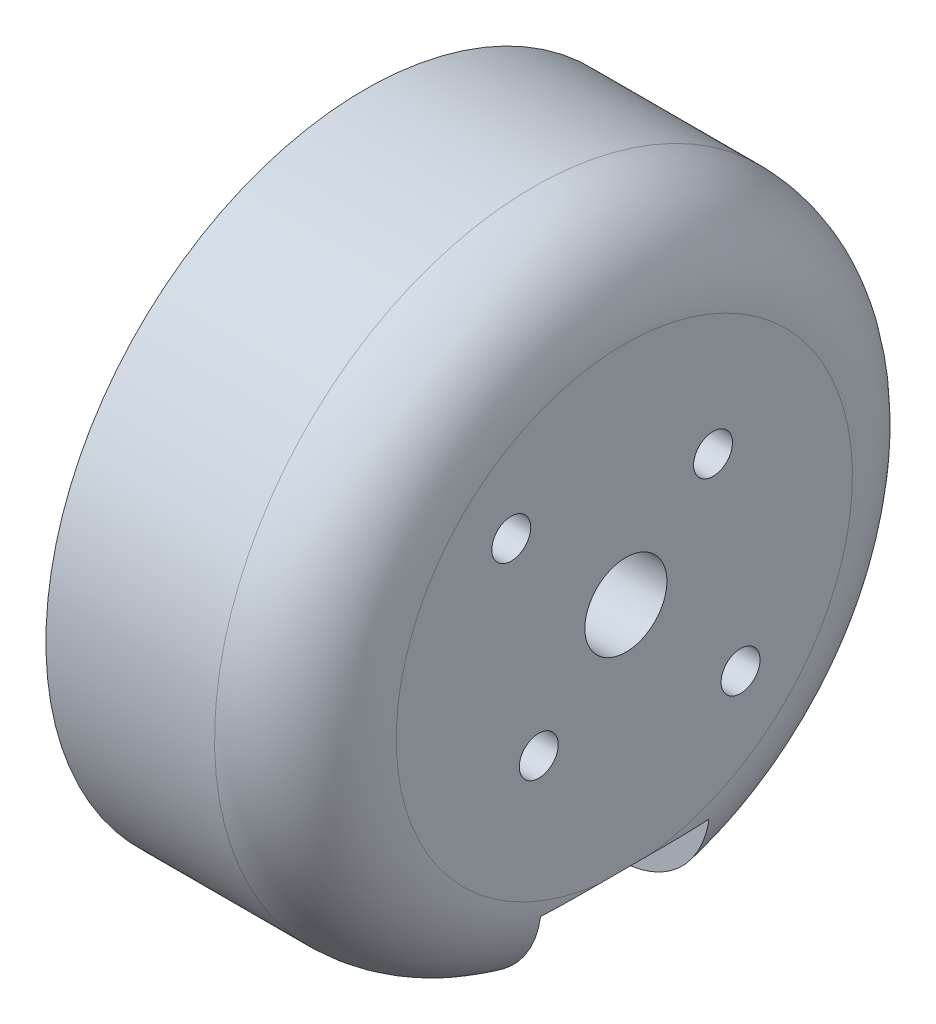
from build123d import *

# Parameters (mm, degrees)
SKETCH1_R           = 24.584865892
BOSS_EXTRUDE4_DEPTH = 20
SKETCH5_R           = 17.9
BOSS_EXTRUDE5_DEPTH = 5
SKETCH6_R           = 1.5
SKETCH6_R_2         = 3.162859367
CUT_EXTRUDE1_DEPTH  = 10
FILLET1_R           = 7
SKETCH8_W           = 13
SKETCH8_H           = 8.974684843
CUT_EXTRUDE2_DEPTH  = 30


with BuildPart() as part:
    # Sketch1 → Boss-Extrude4 (new body)
    with BuildSketch(Plane(origin=(0, 0, 0), x_dir=(0, 0, -1), z_dir=(1, 0, 0))):
        with Locations((69.470275966, 107.4)):
            Circle(SKETCH1_R)
    extrude(amount=BOSS_EXTRUDE4_DEPTH)

    # Cut-Loft1: read off the stored shape, not the designer's step
    # Cut-Loft1: loft between two sections, ruled curve by curve
    cut_loft1_from = [
        Edge.make_bspline([(0, 122.421030793, -51.5998214), (0, 121.403963567, -50.977061653), (0, 120.31454314, -50.395752434), (0, 118.005938422, -49.358232659), (0, 116.786749472, -48.902260973), (0, 114.249384519, -48.15409937), (0, 112.931336418, -47.862145319), (0, 110.241321726, -47.469427252), (0, 108.869602219, -47.368811755), (0, 106.125867826, -47.368811755), (0, 104.754148319, -47.469427252), (0, 102.064133627, -47.862145319), (0, 100.746085526, -48.15409937), (0, 98.208720572, -48.902260973), (0, 96.989531623, -49.358232659), (0, 94.680926905, -50.395752434), (0, 93.591506478, -50.977061653), (0, 92.574439252, -51.5998214)], [0, 0, 0, 0, 0.125, 0.125, 0.25, 0.25, 0.375, 0.375, 0.5, 0.5, 0.625, 0.625, 0.75, 0.75, 0.875, 0.875, 1, 1, 1, 1], 3),
        Edge.make_bspline([(0, 92.574439252, -51.5998214), (0, 91.688670965, -52.66973324), (0, 90.833868812, -53.859032932), (0, 89.270225328, -56.474339023), (0, 88.562039976, -57.900649218), (0, 87.380791607, -60.949300184), (0, 86.90857847, -62.571462387), (0, 86.269439046, -65.928597857), (0, 86.103133633, -67.662819685), (0, 86.103133633, -71.132277338), (0, 86.269439046, -72.866499165), (0, 86.90857847, -76.223634636), (0, 87.380791607, -77.845796839), (0, 88.562039976, -80.894447804), (0, 89.270225328, -82.320757999), (0, 90.833868812, -84.93606409), (0, 91.688670965, -86.125363783), (0, 92.574439252, -87.195275623)], [0, 0, 0, 0, 0.125, 0.125, 0.25, 0.25, 0.375, 0.375, 0.5, 0.5, 0.625, 0.625, 0.75, 0.75, 0.875, 0.875, 1, 1, 1, 1], 3),
        Edge.make_bspline([(0, 122.421030793, -87.195275623), (0, 123.30679908, -86.125363783), (0, 124.161601233, -84.93606409), (0, 125.725244717, -82.320757999), (0, 126.433430069, -80.894447804), (0, 127.614678438, -77.845796839), (0, 128.086891575, -76.223634636), (0, 128.726030999, -72.866499165), (0, 128.892336412, -71.132277338), (0, 128.892336412, -67.662819685), (0, 128.726030999, -65.928597857), (0, 128.086891575, -62.571462387), (0, 127.614678438, -60.949300184), (0, 126.433430069, -57.900649218), (0, 125.725244717, -56.474339023), (0, 124.161601233, -53.859032932), (0, 123.30679908, -52.66973324), (0, 122.421030793, -51.5998214)], [0, 0, 0, 0, 0.125, 0.125, 0.25, 0.25, 0.375, 0.375, 0.5, 0.5, 0.625, 0.625, 0.75, 0.75, 0.875, 0.875, 1, 1, 1, 1], 3),
        Edge.make_bspline([(0, 92.574439252, -87.195275623), (0, 93.591506478, -87.818035369), (0, 94.680926905, -88.399344588), (0, 96.989531623, -89.436864364), (0, 98.208720572, -89.89283605), (0, 100.746085526, -90.640997653), (0, 102.064133627, -90.932951704), (0, 104.754148319, -91.325669771), (0, 106.125867826, -91.426285268), (0, 108.869602219, -91.426285268), (0, 110.241321726, -91.325669771), (0, 112.931336418, -90.932951704), (0, 114.249384519, -90.640997653), (0, 116.786749472, -89.89283605), (0, 118.005938422, -89.436864364), (0, 120.31454314, -88.399344588), (0, 121.403963567, -87.818035369), (0, 122.421030793, -87.195275623)], [0, 0, 0, 0, 0.125, 0.125, 0.25, 0.25, 0.375, 0.375, 0.5, 0.5, 0.625, 0.625, 0.75, 0.75, 0.875, 0.875, 1, 1, 1, 1], 3),
    ]
    cut_loft1_to = [
        Edge.make_bspline([(15, 121.083565639, -53.151068005), (15, 120.209787037, -52.418409479), (15, 119.250887023, -51.73451628), (15, 117.180423625, -50.51390478), (15, 116.06885476, -49.977467502), (15, 113.729261674, -49.097277381), (15, 112.501387925, -48.753802027), (15, 109.982206911, -48.291780772), (15, 108.691190331, -48.173409599), (15, 106.108809669, -48.173409599), (15, 104.817793089, -48.291780772), (15, 102.298612075, -48.753802027), (15, 101.070738326, -49.097277381), (15, 98.73114524, -49.977467502), (15, 97.619576375, -50.51390478), (15, 95.549112977, -51.73451628), (15, 94.590212963, -52.418409479), (15, 93.716434361, -53.151068005)], [0, 0, 0, 0, 0.125, 0.125, 0.25, 0.25, 0.375, 0.375, 0.5, 0.5, 0.625, 0.625, 0.75, 0.75, 0.875, 0.875, 1, 1, 1, 1], 3),
        Edge.make_bspline([(15, 93.716434361, -53.151068005), (15, 92.674354023, -54.024846606), (15, 91.668704432, -55.039081505), (15, 89.829123863, -57.346029779), (15, 88.995964625, -58.639100564), (15, 87.606260661, -61.455866338), (15, 87.050715794, -62.979351249), (15, 86.29878706, -66.15903997), (15, 86.103133633, -67.814359733), (15, 86.103133633, -71.126192199), (15, 86.29878706, -72.781511962), (15, 87.050715794, -75.961200683), (15, 87.606260661, -77.484685594), (15, 88.995964625, -80.301451369), (15, 89.829123863, -81.594522153), (15, 91.668704432, -83.901470427), (15, 92.674354023, -84.915705326), (15, 93.716434361, -85.789483927)], [0, 0, 0, 0, 0.125, 0.125, 0.25, 0.25, 0.375, 0.375, 0.5, 0.5, 0.625, 0.625, 0.75, 0.75, 0.875, 0.875, 1, 1, 1, 1], 3),
        Edge.make_bspline([(15, 121.083565639, -85.789483927), (15, 122.125645977, -84.915705326), (15, 123.131295568, -83.901470427), (15, 124.970876137, -81.594522153), (15, 125.804035375, -80.301451369), (15, 127.193739339, -77.484685594), (15, 127.749284206, -75.961200683), (15, 128.50121294, -72.781511962), (15, 128.696866367, -71.126192199), (15, 128.696866367, -67.814359733), (15, 128.50121294, -66.15903997), (15, 127.749284206, -62.979351249), (15, 127.193739339, -61.455866338), (15, 125.804035375, -58.639100564), (15, 124.970876137, -57.346029779), (15, 123.131295568, -55.039081505), (15, 122.125645977, -54.024846606), (15, 121.083565639, -53.151068005)], [0, 0, 0, 0, 0.125, 0.125, 0.25, 0.25, 0.375, 0.375, 0.5, 0.5, 0.625, 0.625, 0.75, 0.75, 0.875, 0.875, 1, 1, 1, 1], 3),
        Edge.make_bspline([(15, 93.716434361, -85.789483927), (15, 94.590212963, -86.522142453), (15, 95.549112977, -87.206035652), (15, 97.619576375, -88.426647153), (15, 98.73114524, -88.96308443), (15, 101.070738326, -89.843274551), (15, 102.298612075, -90.186749905), (15, 104.817793089, -90.64877116), (15, 106.108809669, -90.767142333), (15, 108.691190331, -90.767142333), (15, 109.982206911, -90.64877116), (15, 112.501387925, -90.186749905), (15, 113.729261674, -89.843274551), (15, 116.06885476, -88.96308443), (15, 117.180423625, -88.426647153), (15, 119.250887023, -87.206035652), (15, 120.209787037, -86.522142453), (15, 121.083565639, -85.789483927)], [0, 0, 0, 0, 0.125, 0.125, 0.25, 0.25, 0.375, 0.375, 0.5, 0.5, 0.625, 0.625, 0.75, 0.75, 0.875, 0.875, 1, 1, 1, 1], 3),
    ]
    cut_loft1 = Solid(Shell([*[Face.make_surface_from_curves(cut_loft1_from[k], cut_loft1_to[k]) for k in range(4)], Face(Wire(cut_loft1_from)), Face(Wire(cut_loft1_to))]))
    add(cut_loft1, mode=Mode.SUBTRACT)

    # Sketch5 → Boss-Extrude5 (add)
    with BuildSketch(Plane.ZY.offset(-15)):
        with Locations(Location((-69.470275966, 107.4, 0), (0, 0, 180))):
            Circle(SKETCH5_R)
    extrude(amount=BOSS_EXTRUDE5_DEPTH)

    # Sketch6 → Cut-Extrude1 (cut)
    with BuildSketch(Plane.ZY.offset(-10)):
        with Locations((-60.753803406, 116.36119697)):
            Circle(SKETCH6_R)
        with Locations((-78.431472936, 98.68352744)):
            Circle(SKETCH6_R)
        with Locations((-76.310152592, 114.239876626)):
            Circle(SKETCH6_R)
        with Locations((-62.87512375, 100.804847784)):
            Circle(SKETCH6_R)
        with Locations((-69.592638171, 107.522362205)):
            Circle(SKETCH6_R_2)
    extrude(amount=-CUT_EXTRUDE1_DEPTH, mode=Mode.SUBTRACT)

    # Fillet1
    fillet1_edges = [part.edges().sort_by_distance(p)[0] for p in [
        (20, 107.4, -44.885410074),
    ]]
    fillet(fillet1_edges, radius=FILLET1_R)

    # Sketch8 → Cut-Extrude2 (cut)
    with BuildSketch(Plane(origin=(20, 0, 0), x_dir=(0, 0, -1), z_dir=(1, 0, 0))):
        with Locations((69.592638171, 85.435019783)):
            Rectangle(SKETCH8_W, SKETCH8_H)
    extrude(amount=-CUT_EXTRUDE2_DEPTH, mode=Mode.SUBTRACT)


solid = part.part
